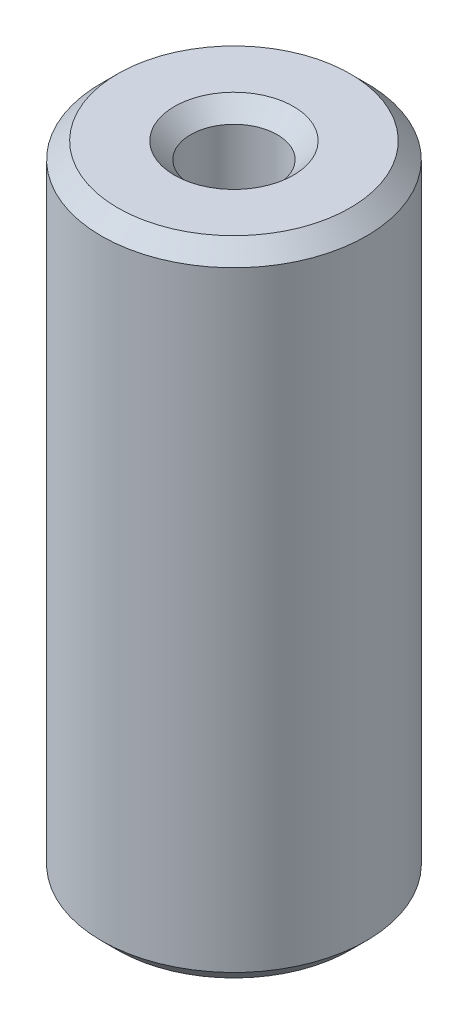
from build123d import *

# Parameters (mm, degrees)
SKETCH1_R           = 10
BOSS_EXTRUDE1_DEPTH = 48.522565586
SKETCH2_R           = 3.267026711
CUT_EXTRUDE1_DEPTH  = 51.541461901
CHAMFER1_SIZE       = 1.228371825


with BuildPart() as part:
    # Sketch1 → Boss-Extrude1 (new body)
    with BuildSketch(Plane(origin=(0, 0, 0), x_dir=(1, 0, 0), z_dir=(0, 1, 0))):
        Circle(SKETCH1_R)
    extrude(amount=BOSS_EXTRUDE1_DEPTH)

    # Sketch2 → Cut-Extrude1 (cut, through all)
    with BuildSketch(Plane(origin=(0, 0, 0), x_dir=(1, 0, 0), z_dir=(0, 1, 0))):
        Circle(SKETCH2_R)
    extrude(amount=CUT_EXTRUDE1_DEPTH, mode=Mode.SUBTRACT)

    # Chamfer1
    chamfer1_edges = [part.edges().sort_by_distance(p)[0] for p in [
        (-3.267026711, 48.522565586, 0),
        (-3.267026711, 0, 0),
        (-10, 0, 0),
        (-10, 48.522565586, 0),
    ]]
    chamfer(chamfer1_edges, length=CHAMFER1_SIZE)


solid = part.part
